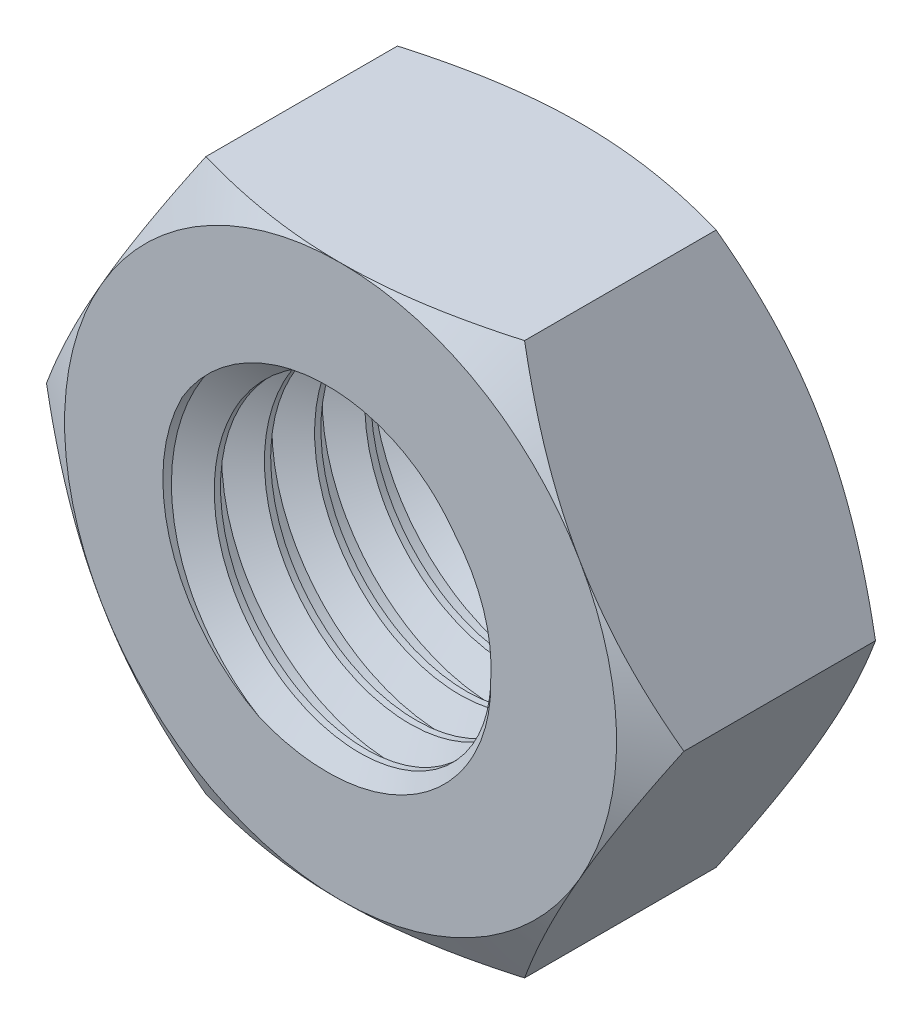
from build123d import *

# Parameters (mm, degrees)
EXTRUDE_1_DEPTH     = 2.400000114
SKETCH_6_R          = 1.500000013
CUT_EXTRUDE_1_DEPTH = 5.837957595
SWEEP_1_PITCH       = 0.500000024


with BuildPart() as part:
    # 草图1 → 拉伸1 (new body)
    with BuildSketch(Plane.XY):
        Polygon((3.175426463, 0), (1.587713232, 2.749999985), (-1.587713232, 2.749999985), (-3.175426463, 0), (-1.587713232, -2.749999985), (1.587713232, -2.749999985), align=None)
    extrude(amount=EXTRUDE_1_DEPTH)

    # 草图3 → 切除-旋转1 (revolve, cut)
    with BuildSketch(Plane(origin=(0, 0, 0), x_dir=(1, 0, 0), z_dir=(0, 1, 0))):
        Polygon((2.749999985, 0), (3.175426463, -0.245620092), (3.175426463, 0), align=None)
    revolve(axis=Axis((0, 0, -4.958997126), (0, 0, 1)), mode=Mode.SUBTRACT)

    # 草图5 → 切除-旋转2 (revolve, cut)
    with BuildSketch(Plane(origin=(0, 0, 0), x_dir=(1, 0, 0), z_dir=(0, 1, 0))):
        Polygon((2.749999985, -2.400000114), (3.175426463, -2.154380022), (3.175426463, -2.400000114), align=None)
    revolve(axis=Axis((0, 0, -5.594352164), (0, 0, 1)), mode=Mode.SUBTRACT)

    # 草图6 → 切除-拉伸1 (cut, through all)
    with BuildSketch(Plane.XY.offset(2.400000114)):
        Circle(SKETCH_6_R)
    extrude(amount=-CUT_EXTRUDE_1_DEPTH, mode=Mode.SUBTRACT)

    # 切除-扫描1: arcs per turn and ends read off the stored shape
    # 切除-扫描1: the profile of 草图7 profile screwed along a right-hand helix through 7 turns, 6 arcs to a turn; built about Z, then put on its axis
    sweep_1_z = Axis((0, 0, 0), (0, 0, 1))
    sweep_1_corners = [(1.770632958, 0, -0.437500021), (1.499700013, 0, -0.281076812), (1.499700013, 0, -0.718923236), (1.770632958, 0, -0.562500027)]
    with BuildLine(mode=Mode.PRIVATE) as sweep_1_profile:
        Line(sweep_1_corners[0], sweep_1_corners[1])
        Line(sweep_1_corners[1], sweep_1_corners[2])
        Line(sweep_1_corners[2], sweep_1_corners[3])
        Line(sweep_1_corners[3], sweep_1_corners[0])
    sweep_1_cap = Face(sweep_1_profile.wire())
    sweep_1_turn_angles = [0, 30, 60, 90, 120, 150, 180, 210, 240, 270, 300, 330, 360]
    sweep_1_turn_weights = [1, 0.8660254037844387, 1, 0.8660254037844387, 1, 0.8660254037844387, 1, 0.8660254037844387, 1, 0.8660254037844387, 1, 0.8660254037844387, 1]
    sweep_1_turn_rails = [Edge.make_bspline([Vector(p[0], p[1], 0).rotate(sweep_1_z, sweep_1_turn_angles[k]) / sweep_1_turn_weights[k] + Vector(0, 0, p[2] + SWEEP_1_PITCH * sweep_1_turn_angles[k] / 360) for k in range(13)], [0, 0, 0, 1, 1, 2, 2, 3, 3, 4, 4, 5, 5, 6, 6, 6], 2, sweep_1_turn_weights) for p in sweep_1_corners]
    sweep_1_turn_sides = [Face.make_surface_from_curves(sweep_1_turn_rails[p[0]], sweep_1_turn_rails[p[1]]) for p in [(0, 1), (1, 2), (2, 3), (3, 0)]]
    sweep_1 = Plane(origin=(0, 0, 0), x_dir=(0, -1, 0), z_dir=(0, 0, 1)) * Solid(Shell([*[p.moved(Location((0, 0, SWEEP_1_PITCH * i))) for i in range(7) for p in sweep_1_turn_sides], sweep_1_cap, sweep_1_cap.rotate(sweep_1_z, 2520).moved(Location((0, 0, SWEEP_1_PITCH * 2520 / 360)))]))
    add(sweep_1, mode=Mode.SUBTRACT)


solid = part.part
